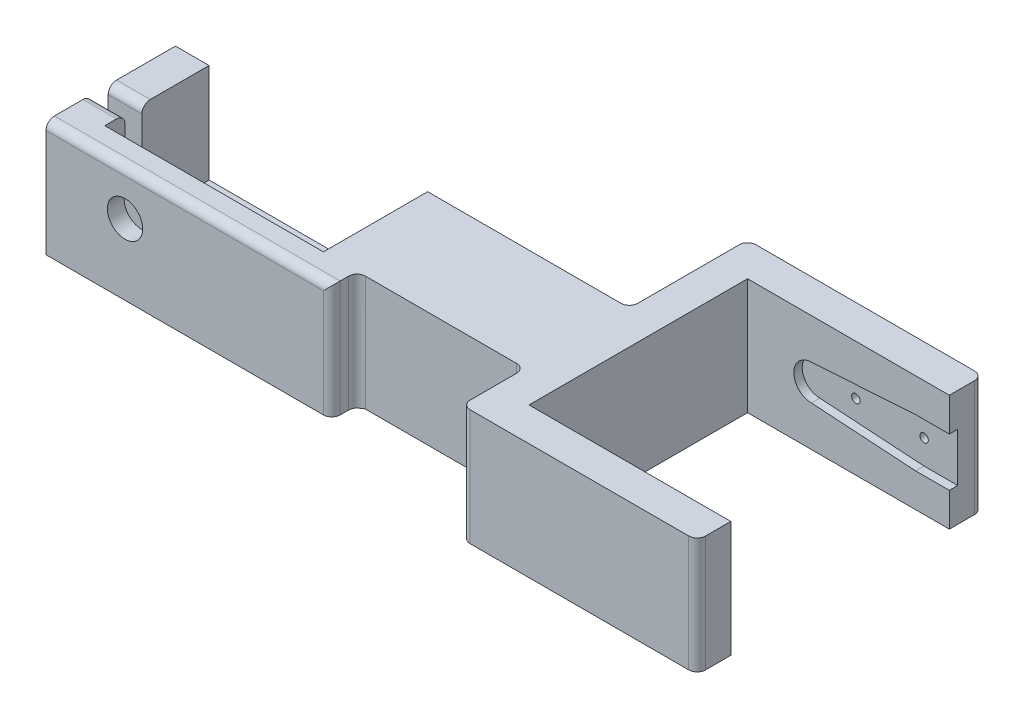
from build123d import *

# Parameters (mm, degrees)
SKETCH1_W                 = 10
SKETCH1_H                 = 29.5
SKETCH1_R                 = 2.75
BOSS_EXTRUDE1_DEPTH       = 15.5
SKETCH15_R                = 2.75
CUT_EXTRUDE5_DEPTH        = 10
SKETCH2_W                 = 85
SKETCH2_H                 = 34.5
SKETCH2_R                 = 5.25
BOSS_EXTRUDE2_DEPTH       = 7.5
SKETCH4_W                 = 85
SKETCH4_H                 = 34.5
BOSS_EXTRUDE3_DEPTH       = 10
SKETCH5_W                 = 10
SKETCH5_H                 = 34.5
BOSS_EXTRUDE4_DEPTH       = 60
SKETCH6_R                 = 5
BOSS_EXTRUDE5_DEPTH       = 5
CUT_EXTRUDE2_DEPTH        = 2.5
SKETCH10_W                = 5
SKETCH10_H                = 18.5
CUT_EXTRUDE4_DEPTH        = 10
F_2_5MM_DOWEL_HOLE1_D     = 2.5
F_2_5MM_DOWEL_HOLE1_DEPTH = 10
F_2_5MM_DOWEL_HOLE1_TIP   = 0.751075774
FILLET1_R                 = 2.5
SKETCH14_R                = 5.25
BOSS_EXTRUDE6_DEPTH       = 2.5
FILLET2_R                 = 2.5
SKETCH17_W                = 145
SKETCH17_H                = 12.5
CUT_EXTRUDE7_DEPTH        = 2.5
CHAMFER1_SIZE             = 2.5


# Some blends are built 0.0001 mm under size
with BuildPart() as part:
    # Sketch1 → Boss-Extrude1 (new, symmetric)
    # profile 1 of 8: a face of its own
    with BuildSketch(Plane.XY):
        with Locations((-37.5, -1.25)):
            Rectangle(SKETCH1_W, SKETCH1_H)
        with Locations((-37.5, -8.5)):
            Circle(SKETCH1_R, mode=Mode.SUBTRACT)
        with Locations((-37.5, 8.5)):
            Circle(SKETCH1_R, mode=Mode.SUBTRACT)
    # profile 2 of 8: a face of its own
    with BuildSketch(Plane.XY):
        Polygon((-32.5, -16), (-42.5, -16), (-42.5, -21), (42.5, -21), (42.5, -16), (32.5, -16), align=None)
    # profile 3 of 8: a face of its own
    with BuildSketch(Plane.XY):
        with Locations((37.5, -1.25)):
            Rectangle(SKETCH1_W, SKETCH1_H)
        with Locations((37.5, -8.5)):
            Circle(SKETCH1_R, mode=Mode.SUBTRACT)
        with Locations((37.5, 8.5)):
            Circle(SKETCH1_R, mode=Mode.SUBTRACT)
    # profile 4 of 8: a face of its own
    with BuildSketch(Plane.XY):
        with Locations((-37.5, 8.5)):
            Circle(SKETCH1_R)
    # profile 5 of 8: a face of its own
    with BuildSketch(Plane.XY):
        with Locations((-37.5, -8.5)):
            Circle(SKETCH1_R)
    # profile 6 of 8: a face of its own
    with BuildSketch(Plane.XY):
        with Locations((37.5, 8.5)):
            Circle(SKETCH1_R)
    # profile 7 of 8: a face of its own
    with BuildSketch(Plane.XY):
        with Locations((37.5, -8.5)):
            Circle(SKETCH1_R)
    # profile 8 of 8: a face of its own
    with BuildSketch(Plane.XY):
        Polygon((42.5, -21), (92.5, -21), (92.5, 13.5), (42.5, 13.5), (42.5, -16), align=None)
    extrude(amount=BOSS_EXTRUDE1_DEPTH, both=True)

    # Sketch15 → Cut-Extrude5 (cut)
    with BuildSketch(Plane(origin=(0, 0, -15.5), x_dir=(-1, 0, 0), z_dir=(0, 0, -1))):
        with Locations((-37.5, 8.5)):
            Circle(SKETCH15_R)
        with Locations((-37.5, -8.5)):
            Circle(SKETCH15_R)
        with Locations((37.5, 8.5)):
            Circle(SKETCH15_R)
        with Locations((37.5, -8.5)):
            Circle(SKETCH15_R)
    extrude(amount=-CUT_EXTRUDE5_DEPTH, mode=Mode.SUBTRACT)

    # Sketch2 → Boss-Extrude2 (add)
    with BuildSketch(Plane.XY.offset(15.5)):
        with Locations((0, -3.75)):
            Rectangle(SKETCH2_W, SKETCH2_H)
        with Locations((-19, 0)):
            Circle(SKETCH2_R, mode=Mode.SUBTRACT)
    extrude(amount=BOSS_EXTRUDE2_DEPTH)

    # Sketch4 → Boss-Extrude3 (add)
    with BuildSketch(Plane(origin=(92.5, 0, 0), x_dir=(0, 0, -1), z_dir=(1, 0, 0))):
        with Locations((8.15, -3.75)):
            Rectangle(SKETCH4_W, SKETCH4_H)
    extrude(amount=BOSS_EXTRUDE3_DEPTH)

    # Sketch5 → Boss-Extrude4 (add)
    with BuildSketch(Plane(origin=(102.5, 0, 0), x_dir=(0, 0, -1), z_dir=(1, 0, 0))):
        with Locations((-29.35, -3.75)):
            Rectangle(SKETCH5_W, SKETCH5_H)
        with Locations((45.65, -3.75)):
            Rectangle(SKETCH5_W, SKETCH5_H)
    extrude(amount=BOSS_EXTRUDE4_DEPTH)

    # Sketch6 → Boss-Extrude5 (add)
    with BuildSketch(Plane(origin=(0, 0, 24.35), x_dir=(-1, 0, 0), z_dir=(0, 0, -1))):
        with Locations(Location((-152.5, -3.75, 0), (0, 0, 270))):
            Circle(SKETCH6_R)
    extrude(amount=BOSS_EXTRUDE5_DEPTH)

    # Sketch8 → Cut-Extrude2 (cut)
    with BuildSketch(Plane.XY.offset(-40.65)):
        with BuildLine():
            ThreePointArc((121.500000004, 1.499999993), (116.250000004, -3.750000007), (121.500000004, -9.000000007))
            Line((121.500000004, -9.000000007), (152.500000004, -11.000000007))
            Line((152.500000004, -11.000000007), (162.5, -11.000000007))
            Line((162.5, -11.000000007), (162.5, 3.499999993))
            Line((162.5, 3.499999993), (152.500000004, 3.499999993))
            Line((152.500000004, 3.499999993), (121.500000004, 1.499999993))
        make_face()
    extrude(amount=-CUT_EXTRUDE2_DEPTH, mode=Mode.SUBTRACT)

    # Sketch10 → Cut-Extrude4 (cut)
    with BuildSketch(Plane.ZY.offset(42.5)):
        with Locations((7, 4.25)):
            Rectangle(SKETCH10_W, SKETCH10_H)
    extrude(amount=-CUT_EXTRUDE4_DEPTH, mode=Mode.SUBTRACT)

    # Ø2.5mm Dowel Hole1
    with Locations(Plane(origin=(0, 0, -50.65), x_dir=(-1, 0, 0), z_dir=(0, 0, -1))):
        with Locations((-132.2, -3.75), (-152.5, -3.75)):
            Hole(F_2_5MM_DOWEL_HOLE1_D / 2, depth=F_2_5MM_DOWEL_HOLE1_DEPTH)
            with Locations((0, 0, -(F_2_5MM_DOWEL_HOLE1_DEPTH + F_2_5MM_DOWEL_HOLE1_TIP / 2))):  # 118° drill point
                Cone(0, F_2_5MM_DOWEL_HOLE1_D / 2, F_2_5MM_DOWEL_HOLE1_TIP, mode=Mode.SUBTRACT)

    # Fillet1
    fillet1_edges = [part.edges().sort_by_distance(p)[0] for p in [
        (92.5, -3.75, -15.5),
        (92.5, -3.75, 15.5),
        (42.5, -3.75, 23),
        (0, 13.5, 23),
        (42.5, -3.75, 15.5),
        (92.5, -3.75, -50.65),
        (92.5, -3.75, 34.35),
        (162.5, -3.75, 34.35),
        (162.5, -3.75, -50.65),
    ]]
    fillet(fillet1_edges, radius=FILLET1_R)

    # Sketch14 → Boss-Extrude6 (add)
    with BuildSketch(Plane(origin=(0, 0, 15.5), x_dir=(-1, 0, 0), z_dir=(0, 0, -1))):
        with Locations((19, 0)):
            Circle(SKETCH14_R)
    extrude(amount=-BOSS_EXTRUDE6_DEPTH)

    # Fillet2
    fillet2_edges = [part.edges().sort_by_distance(p)[0] for p in [
        (-37.5, -5, 9.5),
        (-37.5, -5, 4.5),
    ]]
    fillet(fillet2_edges, radius=FILLET2_R - 0.0001)  # a hair under: the kernel refuses the full size
    fillet2_2_edges = [part.edges().sort_by_distance(p)[0] for p in [
        (-37.5, 13.5, 9.5),
        (-37.5, 13.5, 4.5),
    ]]
    fillet(fillet2_2_edges, radius=FILLET2_R)

    # Sketch17 → Cut-Extrude7 (cut)
    with BuildSketch(Plane.XZ.offset(21)):
        with Locations((30, 7)):
            Rectangle(SKETCH17_W, SKETCH17_H)
    extrude(amount=-CUT_EXTRUDE7_DEPTH, mode=Mode.SUBTRACT)

    # Chamfer1
    # the kernel refuses this chamfer: 2.5 mm, written as the material it takes off along each edge
    with BuildSketch(Plane(origin=(108.92920747, -21, 0.75), x_dir=(0, -0.027495876610586317, -0.9996219169112968), z_dir=(-1, 0, 0))) as chamfer1_piece_1_section:
        Polygon((CHAMFER1_SIZE * 0.999621916911, -CHAMFER1_SIZE * 0.0274958766106), (-CHAMFER1_SIZE * 0.0274958766106, -CHAMFER1_SIZE * 0.999621916911), (0, 0), align=None)
    chamfer1_piece_1 = extrude(amount=157.85841494, mode=Mode.PRIVATE)
    chamfer1_piece_1 = split(chamfer1_piece_1, bisect_by=Plane(origin=(30, -18.5, -0.076010386), z_dir=(0, -1, 0)), keep=Keep.TOP, mode=Mode.PRIVATE)
    add(chamfer1_piece_1, mode=Mode.SUBTRACT)
    with BuildSketch(Plane(origin=(-48.92920747, -21, 13.25), x_dir=(0, 0.9996219169112968, -0.027495876610586317), z_dir=(1, 0, 0))) as chamfer1_piece_2_section:
        Polygon((CHAMFER1_SIZE * 0.999621916911, CHAMFER1_SIZE * 0.0274958766106), (-CHAMFER1_SIZE * 0.0274958766106, CHAMFER1_SIZE * 0.999621916911), (0, 0), align=None)
    chamfer1_piece_2 = extrude(amount=157.85841494, mode=Mode.PRIVATE)
    chamfer1_piece_2 = split(chamfer1_piece_2, bisect_by=Plane(origin=(30, -18.5, 14.076010386), z_dir=(0, -1, 0)), keep=Keep.TOP, mode=Mode.PRIVATE)
    add(chamfer1_piece_2, mode=Mode.SUBTRACT)


solid = part.part
